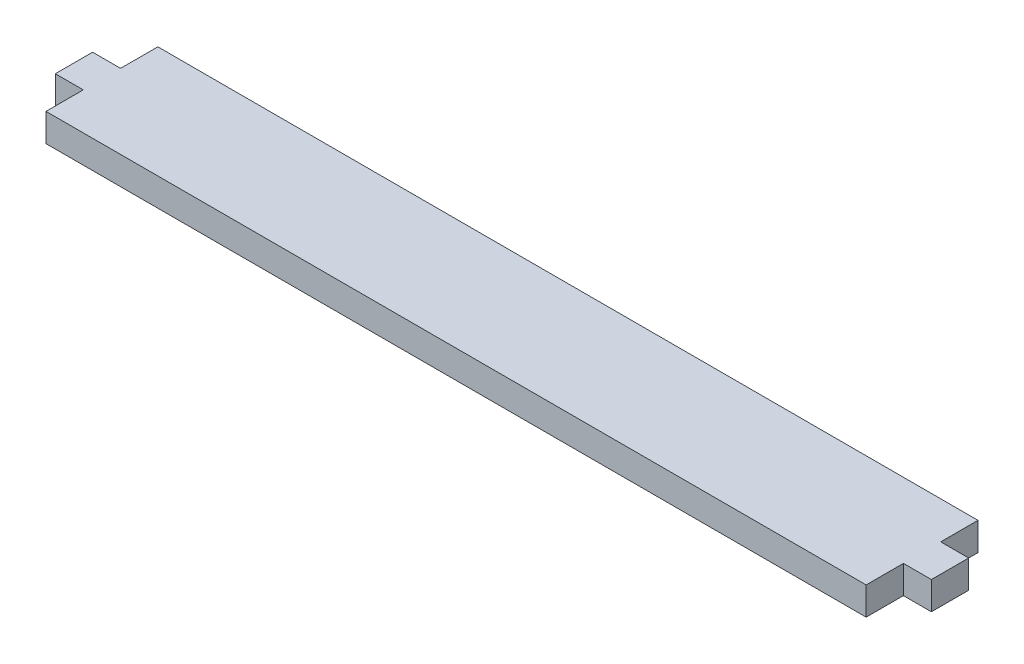
from build123d import *

# Parameters (mm, degrees)
SKETCH1_W           = 279.4
SKETCH1_H           = 38.1
BOSS_EXTRUDE1_DEPTH = 9.525
SKETCH2_W           = 12.7
SKETCH2_H           = 9.525
BOSS_EXTRUDE2_DEPTH = 9.525


with BuildPart() as part:
    # Sketch1 → Boss-Extrude1 (new body)
    with BuildSketch(Plane(origin=(0, 0, 0), x_dir=(1, 0, 0), z_dir=(0, 1, 0))):
        Rectangle(SKETCH1_W, SKETCH1_H)
    extrude(amount=BOSS_EXTRUDE1_DEPTH)

    # Sketch2 → Boss-Extrude2 (add)
    with BuildSketch(Plane(origin=(139.7, 0, 0), x_dir=(0, 0, -1), z_dir=(1, 0, 0))):
        with Locations((0, 4.7625)):
            Rectangle(SKETCH2_W, SKETCH2_H)
    boss_extrude2 = extrude(amount=BOSS_EXTRUDE2_DEPTH)

    # Mirror1: Boss-Extrude2 across plane
    add(boss_extrude2.mirror(Plane(origin=(0, 0, 0), x_dir=(0, 0, 1), z_dir=(1, 0, 0))))


solid = part.part
